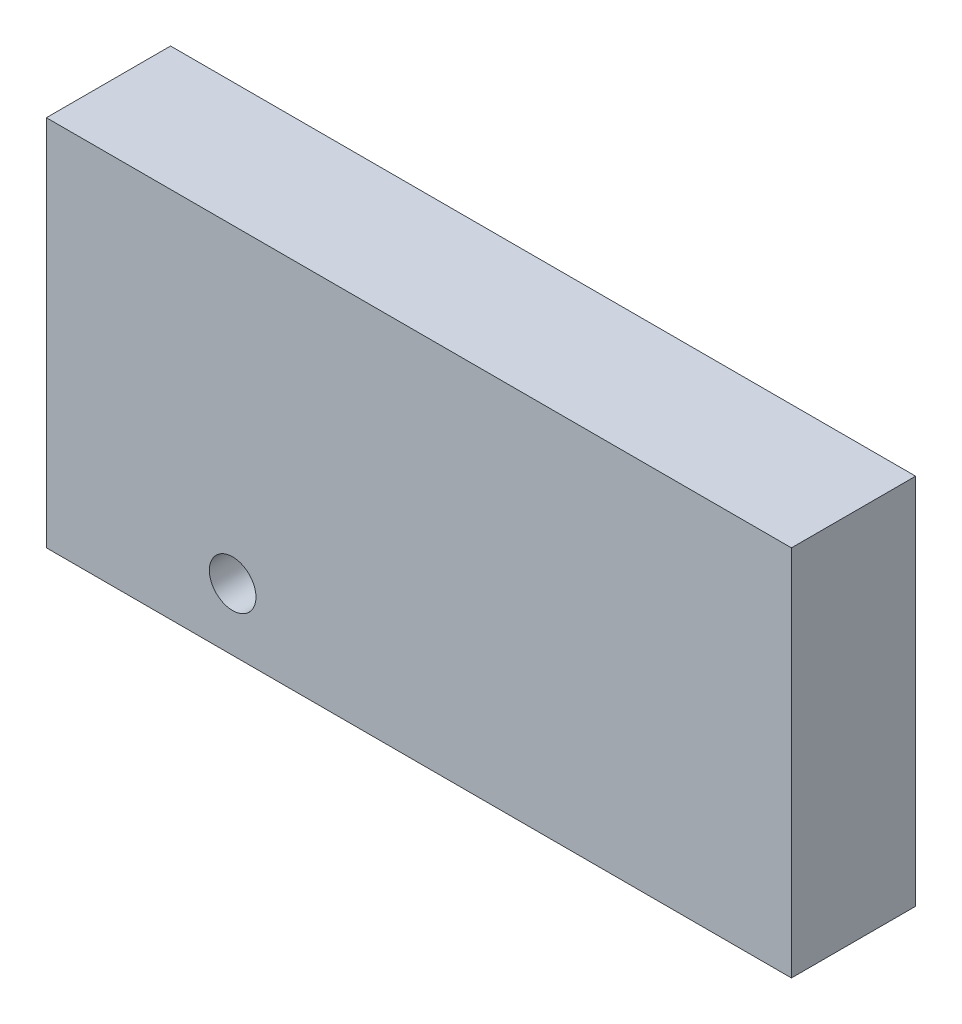
from build123d import *

# Parameters (mm, degrees)
SKETCH1_W             = 152.4
SKETCH1_H             = 76.2
BOSS_EXTRUDE1_DEPTH   = 25.4
SKETCH2_R             = 4.7625
CUT_EXTRUDE1_DEPTH    = 12.7
SKETCH3_R             = 4.7625
CUT_EXTRUDE2_DEPTH    = 12.7
SKETCH4_R             = 9.525
BOSS_EXTRUDE2_DEPTH   = 12.7
SKETCH5_R             = 9.525
BOSS_EXTRUDE3_DEPTH   = 12.7
BOSS_EXTRUDE3_2_DEPTH = 12.7


with BuildPart() as part:
    # Sketch1 → Boss-Extrude1 (new body)
    with BuildSketch(Plane.XY):
        Rectangle(SKETCH1_W, SKETCH1_H)
    extrude(amount=BOSS_EXTRUDE1_DEPTH)

    # Sketch2 → Cut-Extrude1 (cut)
    with BuildSketch(Plane.XY.offset(25.4)):
        with Locations((-38.1, -25.4)):
            Circle(SKETCH2_R)
    extrude(amount=-CUT_EXTRUDE1_DEPTH, mode=Mode.SUBTRACT)

    # Sketch3 → Cut-Extrude2 (cut)
    with BuildSketch(Plane(origin=(0, 0, 0), x_dir=(-1, 0, 0), z_dir=(0, 0, -1))):
        with Locations((63.5, 25.4)):
            Circle(SKETCH3_R)
        with Locations((-63.5, 25.4)):
            Circle(SKETCH3_R)
    extrude(amount=-CUT_EXTRUDE2_DEPTH, mode=Mode.SUBTRACT)


with BuildPart() as body_2:
    # Sketch4 → Boss-Extrude2 (new body)
    with BuildSketch(Plane.XY.offset(25.4)):
        with Locations((-38.1, -25.4)):
            Circle(SKETCH4_R)
    extrude(amount=-BOSS_EXTRUDE2_DEPTH)


with BuildPart() as body_3:
    # Sketch5 → Boss-Extrude3 (new body)
    with BuildSketch(Plane(origin=(0, 0, 0), x_dir=(-1, 0, 0), z_dir=(0, 0, -1))):
        with Locations((-63.5, 25.4)):
            Circle(SKETCH5_R)
    extrude(amount=-BOSS_EXTRUDE3_DEPTH)


with BuildPart() as body_4:
    # Sketch5 → Boss-Extrude3 2 (new body)
    with BuildSketch(Plane(origin=(0, 0, 0), x_dir=(-1, 0, 0), z_dir=(0, 0, -1))):
        with Locations((63.5, 25.4)):
            Circle(SKETCH5_R)
    extrude(amount=-BOSS_EXTRUDE3_2_DEPTH)


solid = part.part
